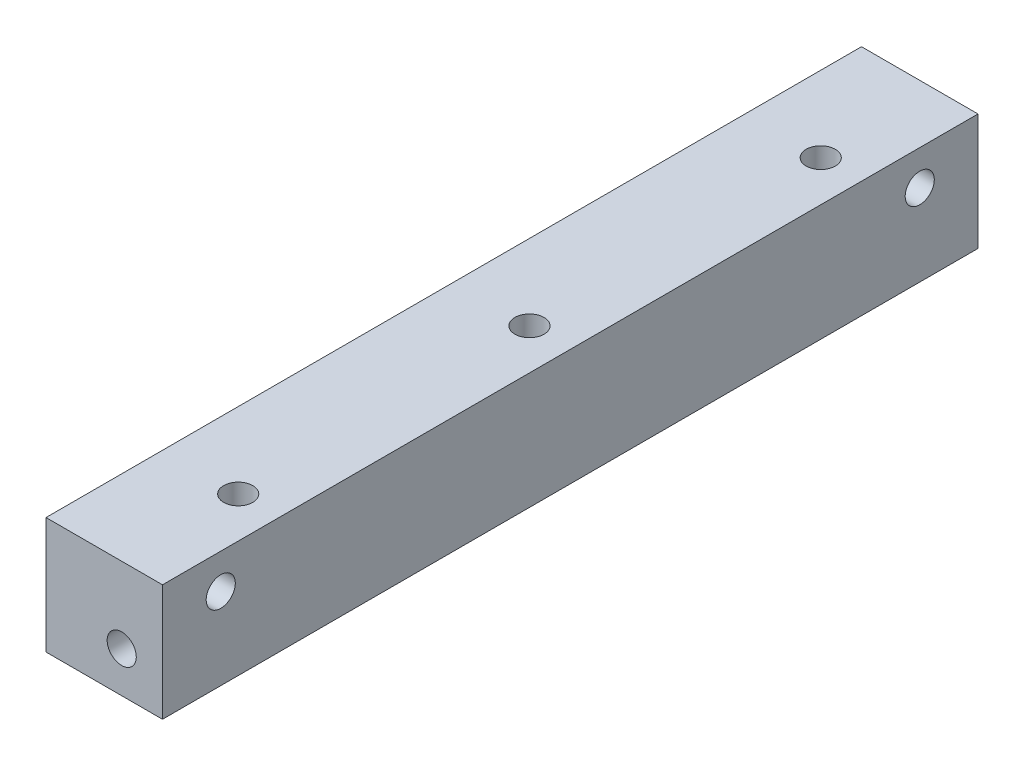
from build123d import *

# Parameters (mm, degrees)
IZIM1_W                          = 20
IZIM1_H                          = 20
Y_KSEKLIK_EKSTR_ZYON1_DEPTH      = 140
F_4_0MM_SAPLAMA_DELIKLERI3_D     = 5
F_4_0MM_SAPLAMA_DELIKLERI3_DEPTH = 10
F_4_0MM_SAPLAMA_DELIKLERI4_D     = 5
F_4_0MM_SAPLAMA_DELIKLERI4_DEPTH = 10
IZIM13_R                         = 2.5
KES_EKSTR_ZYON1_DEPTH            = 10
KES_EKSTR_ZYON2_START            = -10
IZIM15_R                         = 2.5
KES_EKSTR_ZYON2_DEPTH            = 10
IZIM18_R                         = 2.5
KES_EKSTR_ZYON3_DEPTH            = 10
IZIM20_R                         = 2.5
KES_EKSTR_ZYON4_DEPTH            = 10


with BuildPart() as part:
    # Çizim1 → Yükseklik-Ekstrüzyon1 (new body)
    with BuildSketch(Plane.XY):
        with Locations((10, 10)):
            Rectangle(IZIM1_W, IZIM1_H)
    extrude(amount=Y_KSEKLIK_EKSTR_ZYON1_DEPTH)

    # Ø4.0mm Saplama Delikleri3
    with Locations(Plane(origin=(0, 7, 20), x_dir=(0, 0, -1), z_dir=(-1, 0, 0))):
        with Locations((0, 0), (-50, 0), (-100, 0)):
            Hole(F_4_0MM_SAPLAMA_DELIKLERI3_D / 2, depth=F_4_0MM_SAPLAMA_DELIKLERI3_DEPTH)

    # Ø4.0mm Saplama Delikleri4
    with Locations(Plane(origin=(13, 20, 20), x_dir=(0, 0, 1), z_dir=(0, 1, 0))):
        with Locations((0, 0), (50, 0), (100, 0)):
            Hole(F_4_0MM_SAPLAMA_DELIKLERI4_D / 2, depth=F_4_0MM_SAPLAMA_DELIKLERI4_DEPTH)

    # Çizim13 → Kes-Ekstrüzyon1 (cut)
    with BuildSketch(Plane.XY.offset(140)):
        with Locations((13, 7)):
            Circle(IZIM13_R)
    extrude(amount=-KES_EKSTR_ZYON1_DEPTH, mode=Mode.SUBTRACT)

    # Çizim15 → Kes-Ekstrüzyon2 (cut)
    with BuildSketch(Plane(origin=(0, 0, 0), x_dir=(-1, 0, 0), z_dir=(0, 0, -1)).offset(KES_EKSTR_ZYON2_START)):
        with Locations((-13, 7)):
            Circle(IZIM15_R)
    extrude(amount=KES_EKSTR_ZYON2_DEPTH, mode=Mode.SUBTRACT)

    # Çizim18 → Kes-Ekstrüzyon3 (cut)
    with BuildSketch(Plane(origin=(20, 0, 0), x_dir=(0, 0, -1), z_dir=(1, 0, 0))):
        with Locations((-10, 14)):
            Circle(IZIM18_R)
        with Locations((-130, 14)):
            Circle(IZIM18_R)
    extrude(amount=-KES_EKSTR_ZYON3_DEPTH, mode=Mode.SUBTRACT)

    # Çizim20 → Kes-Ekstrüzyon4 (cut)
    with BuildSketch(Plane.XZ):
        with Locations((6, 10)):
            Circle(IZIM20_R)
        with Locations((6, 130)):
            Circle(IZIM20_R)
    extrude(amount=-KES_EKSTR_ZYON4_DEPTH, mode=Mode.SUBTRACT)


solid = part.part
